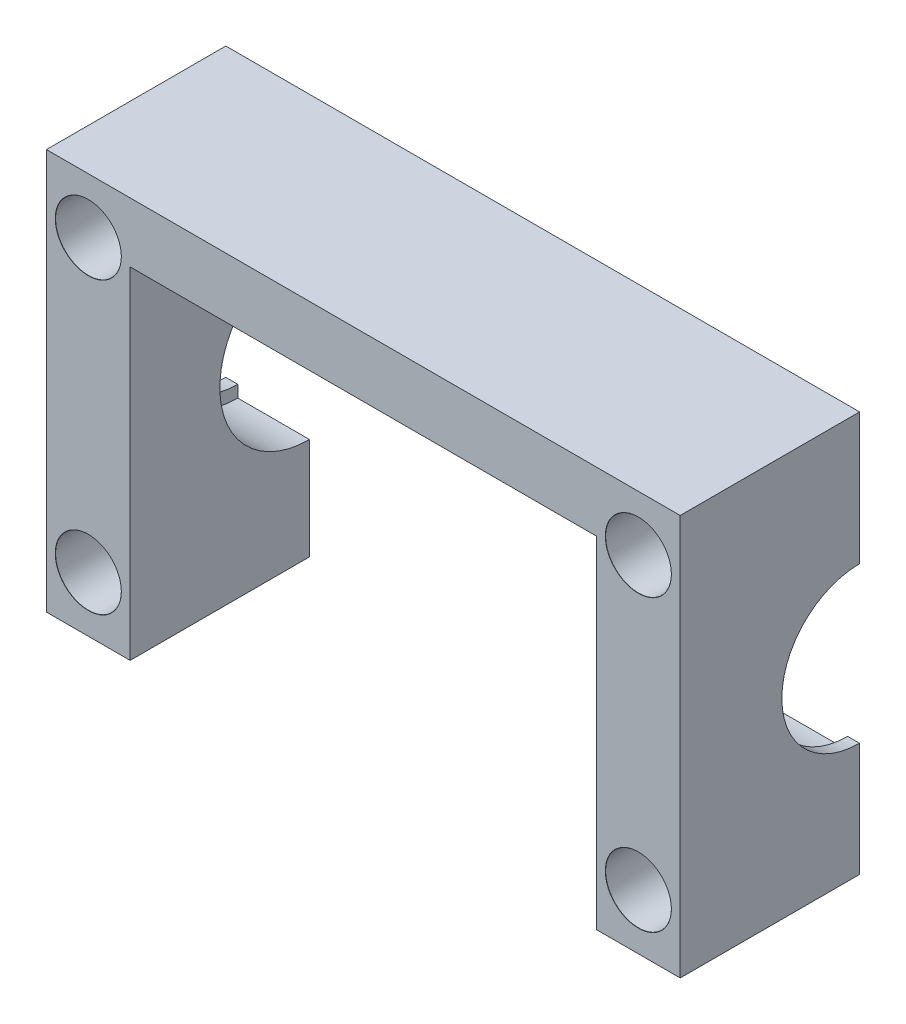
from build123d import *

# Parameters (mm, degrees)
P_IDAT_VYSUNUT_M1_DEPTH = 30


# Read off the part's stored shape, not the designer's step: Válcové zahloubení pro M6 šrouby s vnitřním šestihranem1
with BuildPart() as part:
    # Skica1 → Přidat vysunutím1 (new body)
    with BuildSketch(Plane.XY):
        Polygon((0, 0), (0, 67), (106, 67), (106, 0), (92, 0), (92, 57), (14, 57), (14, 0), align=None)
    extrude(amount=P_IDAT_VYSUNUT_M1_DEPTH)

    # Skica2 → Odebrat rotací1 (revolve, cut)
    with BuildSketch(Plane(origin=(0, 0, 0), x_dir=(-1, 0, 0), z_dir=(0, 0, -1))):
        Polygon((-114, 32), (-114, 19), (-104, 19), (-104, 17), (-2, 17), (-2, 19), (8, 19), (8, 32), align=None)
    revolve(axis=Axis((113.408800735, 32, 0), (-1, 0, 0)), mode=Mode.SUBTRACT)

    # V_lcov_ zahlouben_ pro M6 _rouby s v 2 → Válcové zahloubení pro M6 šrouby s vnitřním šestihranem1 (revolve, cut)
    with BuildSketch(Plane(origin=(99, 9.25, 0), x_dir=(1, 0, 0), z_dir=(0, -1, 0))):
        Polygon((0, 0), (3.3, 0), (3.3, 20.6), (5.5, 20.6), (5.5, 29.975), (5.525, 30), (0, 30), align=None)
    revolve(axis=Axis((99, 9.25, 0), (0, 0, 1)), mode=Mode.SUBTRACT)

    # V_lcov_ zahlouben_ pro M6 _rouby s v 3 o → V_lcov_ zahlouben_ pro M6 _rouby s v 3 (revolve, cut)
    with BuildSketch(Plane(origin=(7, 57.75, 0), x_dir=(1, 0, 0), z_dir=(0, -1, 0))):
        Polygon((0, 30), (0, 0), (3.3, 0), (3.3, 20.6), (5.5, 20.6), (5.5, 29.975), (5.525, 30), align=None)
    revolve(axis=Axis((7, 57.75, 0), (0, 0, 1)), mode=Mode.SUBTRACT)

    # V_lcov_ zahlouben_ pro M6 _rouby s v 4 o → V_lcov_ zahlouben_ pro M6 _rouby s v 4 (revolve, cut)
    with BuildSketch(Plane(origin=(99, 57.75, 0), x_dir=(1, 0, 0), z_dir=(0, -1, 0))):
        Polygon((0, 30), (0, 0), (3.3, 0), (3.3, 20.6), (5.5, 20.6), (5.5, 29.975), (5.525, 30), align=None)
    revolve(axis=Axis((99, 57.75, 0), (0, 0, 1)), mode=Mode.SUBTRACT)

    # V_lcov_ zahlouben_ pro M6 _rouby s v 5 o → V_lcov_ zahlouben_ pro M6 _rouby s v 5 (revolve, cut)
    with BuildSketch(Plane(origin=(7, 9.25, 0), x_dir=(1, 0, 0), z_dir=(0, -1, 0))):
        Polygon((0, 30), (0, 0), (3.3, 0), (3.3, 20.6), (5.5, 20.6), (5.5, 29.975), (5.525, 30), align=None)
    revolve(axis=Axis((7, 9.25, 0), (0, 0, 1)), mode=Mode.SUBTRACT)


solid = part.part
